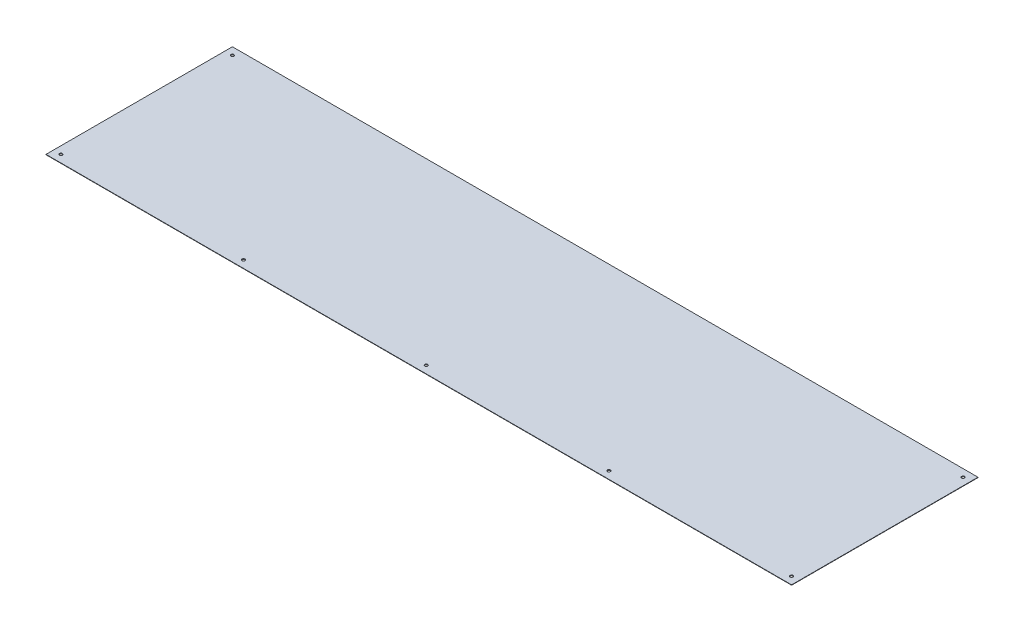
from build123d import *

# Parameters (mm, degrees)
SKETCH1_W           = 2000
SKETCH1_H           = 500
SKETCH1_R           = 3
BOSS_EXTRUDE1_DEPTH = 1
CHAMFER1_SIZE       = 1


with BuildPart() as part:
    # Sketch1 → Boss-Extrude1 (new body)
    with BuildSketch(Plane(origin=(0, 0, 0), x_dir=(1, 0, 0), z_dir=(0, 1, 0))):
        Rectangle(SKETCH1_W, SKETCH1_H)
        with Locations(Location((-980, -230, 0), (0, 0, 270))):
            Circle(SKETCH1_R, mode=Mode.SUBTRACT)
        with Locations(Location((980, -230, 0), (0, 0, 270))):
            Circle(SKETCH1_R, mode=Mode.SUBTRACT)
        with Locations(Location((0, -230, 0), (0, 0, 270))):
            Circle(SKETCH1_R, mode=Mode.SUBTRACT)
        with Locations(Location((-490, -230, 0), (0, 0, 270))):
            Circle(SKETCH1_R, mode=Mode.SUBTRACT)
        with Locations(Location((490, -230, 0), (0, 0, 270))):
            Circle(SKETCH1_R, mode=Mode.SUBTRACT)
        with Locations(Location((980, 230, 0), (0, 0, 270))):
            Circle(SKETCH1_R, mode=Mode.SUBTRACT)
        with Locations(Location((-980, 230, 0), (0, 0, 270))):
            Circle(SKETCH1_R, mode=Mode.SUBTRACT)
    extrude(amount=BOSS_EXTRUDE1_DEPTH)

    # Chamfer1
    chamfer1_edges = [part.edges().sort_by_distance(p)[0] for p in [
        (980, 1, -233),
        (-980, 1, -233),
        (-980, 1, 227),
        (980, 1, 227),
        (0, 1, 227),
        (-490, 1, 227),
        (490, 1, 227),
    ]]
    chamfer(chamfer1_edges, length=CHAMFER1_SIZE - 0.0001)  # a hair under: the kernel refuses the full size


solid = part.part
